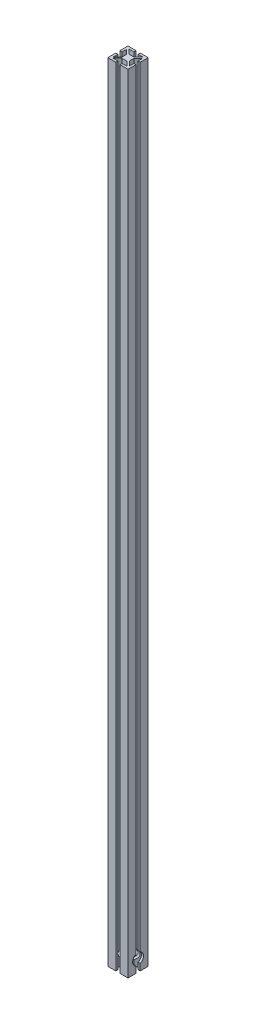
from build123d import *

# Parameters (mm, degrees)
EXTRUDE1_DEPTH = 1485.9
SKETCH2_R      = 10.3124
EXTRUDE2_DEPTH = 16.51


# Read off the part's stored shape, not the designer's step: 1515<1>
with BuildPart() as part:
    # Sketch1<2> → Extrude1 (new body)
    with BuildSketch(Plane(origin=(0, 0, 0), x_dir=(1, 0, 0), z_dir=(0, 1, 0))):
        Polygon((-6.7564, 4.364749804), (-6.7564, -4.364749804), (-14.986, -12.594349804), (-14.986, -4.064), (-19.05, -4.064), (-19.05, -19.05), (-4.064, -19.05), (-4.064, -14.986), (-13.067127258, -14.986), (-4.837527258, -6.7564), (4.837527258, -6.7564), (13.067127258, -14.986), (4.064, -14.986), (4.064, -19.05), (19.05, -19.05), (19.05, -4.064), (14.986, -4.064), (14.986, -12.594349804), (6.7564, -4.364749804), (6.7564, 4.364749804), (14.986, 12.594349804), (14.986, 4.064), (19.05, 4.064), (19.05, 19.05), (4.064, 19.05), (4.064, 14.986), (13.067127258, 14.986), (4.837527258, 6.7564), (-4.837527258, 6.7564), (-13.067127258, 14.986), (-4.064, 14.986), (-4.064, 19.05), (-19.05, 19.05), (-19.05, 4.064), (-14.986, 4.064), (-14.986, 12.594349804), align=None)
    extrude(amount=EXTRUDE1_DEPTH)

    # Sketch2 → Extrude2 (cut)
    with BuildSketch(Plane(origin=(19.05, 0, 0), x_dir=(0, 0, -1), z_dir=(1, 0, 0))):
        with Locations(Location((0, 21.717, 0), (0, 0, 310.932724574))):
            Circle(SKETCH2_R)
    extrude2 = extrude(amount=-EXTRUDE2_DEPTH, mode=Mode.SUBTRACT)

    # Mirror1: Extrude2 across plane
    add(extrude2.mirror(Plane(origin=(0, 0, 0), x_dir=(0, 0, 1), z_dir=(1, 0, 0))), mode=Mode.SUBTRACT)


solid = part.part
